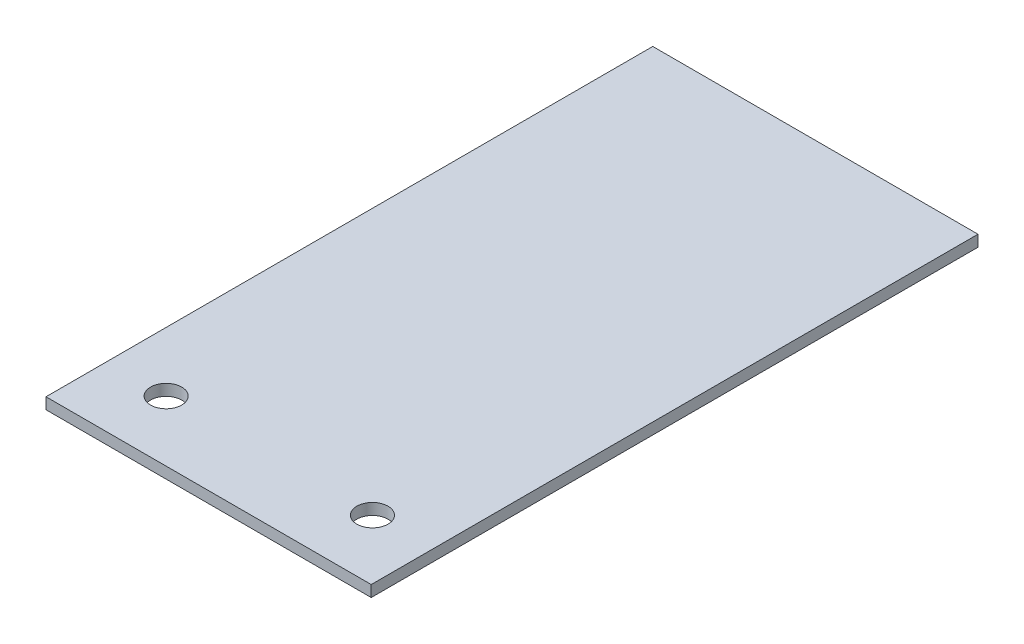
from build123d import *

# Parameters (mm, degrees)
SKETCH1_W           = 68.072
SKETCH1_H           = 127
BOSS_EXTRUDE1_DEPTH = 2.3622
SKETCH2_R           = 3.2639
CUT_EXTRUDE1_DEPTH  = 145.11237689


with BuildPart() as part:
    # Sketch1 → Boss-Extrude1 (new body)
    with BuildSketch(Plane(origin=(0, 0, 0), x_dir=(1, 0, 0), z_dir=(0, 1, 0))):
        with Locations((-34.036, 63.5)):
            Rectangle(SKETCH1_W, SKETCH1_H)
    extrude(amount=BOSS_EXTRUDE1_DEPTH)

    # Sketch2 → Cut-Extrude1 (cut, through all)
    with BuildSketch(Plane(origin=(0, 2.3622, 0), x_dir=(1, 0, 0), z_dir=(0, 1, 0))):
        with Locations((-55.626, 12.7)):
            Circle(SKETCH2_R)
        with Locations((-12.446, 12.7)):
            Circle(SKETCH2_R)
    extrude(amount=-CUT_EXTRUDE1_DEPTH, mode=Mode.SUBTRACT)


solid = part.part
